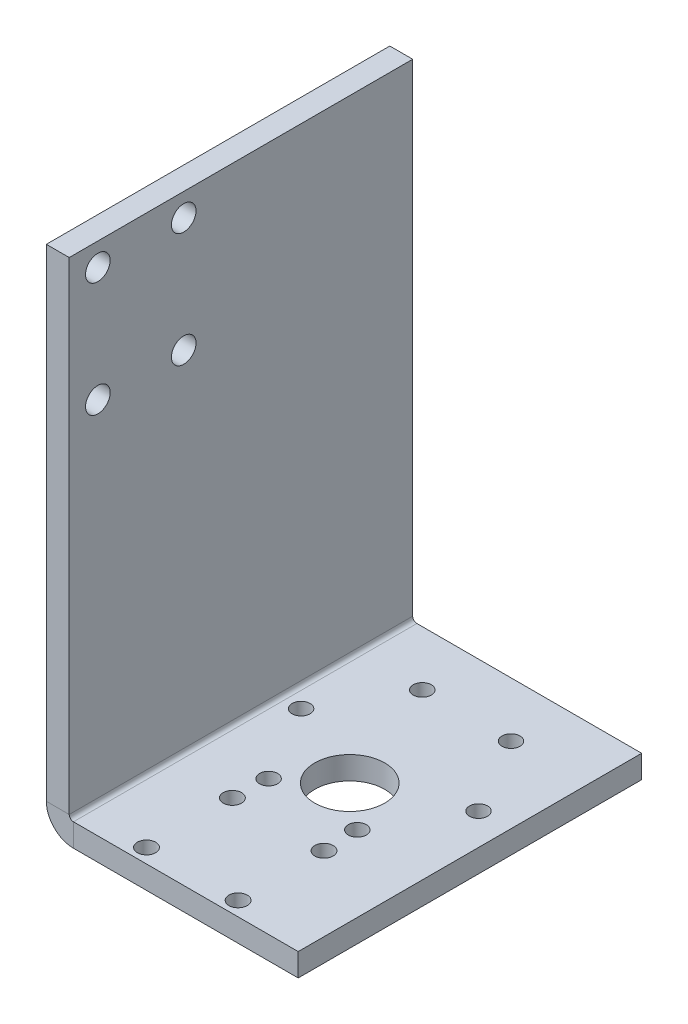
from build123d import *

# Parameters (mm, degrees)
SM_BASE_FLANGE_2_DEPTH = 30
HOLE_WIZARD_M3_1_D     = 3.2
SKETCH_24_R            = 6.1
CUT_EXTRUDE_2_DEPTH    = 103.08329932
HOLE_WIZARD_M4_1_D     = 4.3
HOLE_WIZARD_M2_1_D     = 2.2
HOLE_WIZARD_M3_1_2_D   = 3.15


# Sheet-metal steps are written as plain solids
with BuildPart() as part:
    # 草圖16 → 基材-凸緣2 (new, symmetric)
    with BuildSketch(Plane.XY):
        with BuildLine():
            Line((40, 0), (0.7366, 0))
            ThreePointArc((0.7366, 0), (0.215745145, 0.215745145), (0, 0.7366))
            Line((0, 0.7366), (0, 85))
            Line((0, 85), (-4, 85))
            Line((-4, 85), (-4, 0.7366))
            ThreePointArc((-4, 0.7366), (-2.61268198, -2.61268198), (0.7366, -4))
            Line((0.7366, -4), (40, -4))
            Line((40, -4), (40, 0))
        make_face()
    extrude(amount=SM_BASE_FLANGE_2_DEPTH, both=True)

    # Hole Wizard M3 _1 (through all)
    with Locations(Plane(origin=(0, 0, 0), x_dir=(-1, 0, 0), z_dir=(0, 1, 0))):
        with Locations((-27, 27.5), (-11, 12.5), (-11, 27.5), (-27, 12.5)):
            Hole(HOLE_WIZARD_M3_1_D / 2)

    # 草圖24 → 除料-伸長2 (cut, through all)
    with BuildSketch(Plane.XZ.offset(4)):
        with Locations(Location((19, 0, 0), (0, 0, 270))):
            Circle(SKETCH_24_R)
    extrude(amount=-CUT_EXTRUDE_2_DEPTH, mode=Mode.SUBTRACT)

    # M4 餘隙孔1 (through all)
    with Locations(Plane(origin=(0, 0, 0), x_dir=(0, 0, 1), z_dir=(1, 0, 0))):
        with Locations((10, -81), (25, -81), (25, -61), (10, -61)):
            Hole(HOLE_WIZARD_M4_1_D / 2)

    # M2 餘隙孔1 (through all)
    with Locations(Plane(origin=(0, -4, 0), x_dir=(-1, 0, 0), z_dir=(0, -1, 0))):
        with Locations((-14, 0), (-24, 0)):
            Hole(HOLE_WIZARD_M2_1_D / 2)

    # Hole Wizard M3 _1 2 (through all)
    with Locations(Plane(origin=(0, -4, 0), x_dir=(-1, 0, 0), z_dir=(0, -1, 0))):
        with Locations((-26.75, -6.423393759), (-34.5, 7), (-3.5, 7), (-11.25, -6.423393759), (-11.25, 20.423393759), (-26.75, 20.423393759)):
            Hole(HOLE_WIZARD_M3_1_2_D / 2)


solid = part.part
